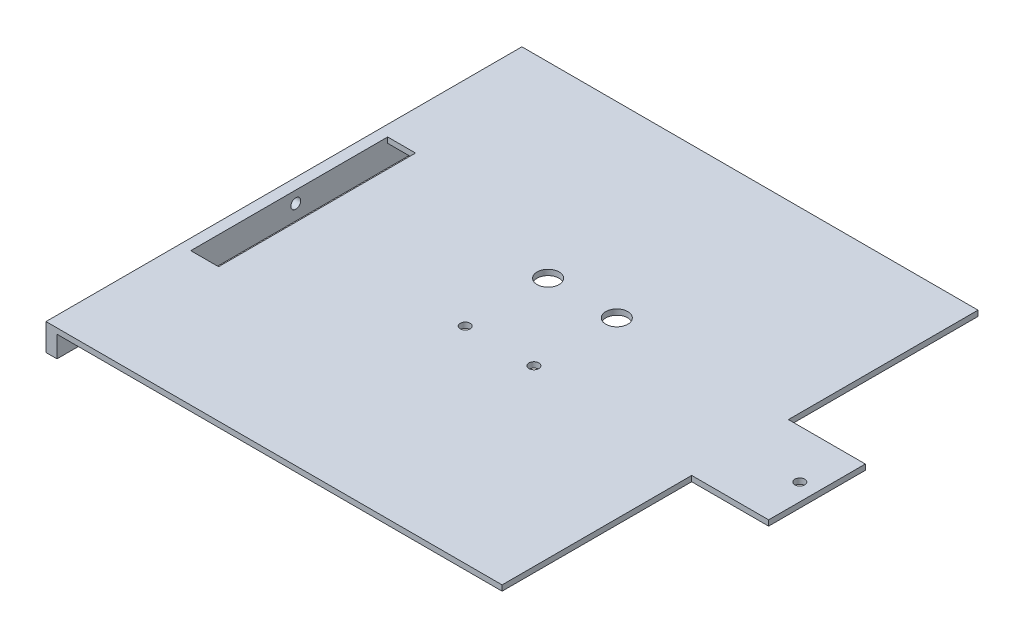
from build123d import *

# Parameters (mm, degrees)
BOSS_EXTRUDE1_DEPTH = 1.27
SKETCH2_R           = 1.143
CUT_EXTRUDE2_DEPTH  = 2.54
SKETCH3_R           = 2.54
SKETCH3_R_2         = 1.143
CUT_EXTRUDE3_DEPTH  = 2.54
SKETCH19_W          = 30.913141625
SKETCH19_H          = 1.27
BOSS_EXTRUDE2_DEPTH = 3.81
SKETCH20_W          = 33.557604238
SKETCH20_H          = 1.27
BOSS_EXTRUDE3_DEPTH = 3.81
SKETCH21_W          = 109.982
SKETCH21_H          = 6.204110365
BOSS_EXTRUDE4_DEPTH = 2.54
SKETCH22_R          = 1.143
CUT_EXTRUDE6_DEPTH  = 2.54


with BuildPart() as part:
    # Sketch1 → Boss-Extrude1 (new body)
    with BuildSketch(Plane(origin=(0, 0, 0), x_dir=(1, 0, 0), z_dir=(0, 1, 0))):
        Polygon((49.53, -54.991), (49.53, -11.176), (67.31, -11.176), (67.31, 11.176), (49.53, 11.176), (49.53, 54.991), (-49.53, 54.991), (-49.53, 21.433395762), (-46.907297859, 21.433395762), (-46.907297859, -24.077858375), (-49.53, -24.077858375), (-49.53, -54.991), align=None)
    extrude(amount=BOSS_EXTRUDE1_DEPTH)

    # Sketch2 → Cut-Extrude2 (cut)
    with BuildSketch(Plane(origin=(0, 1.27, 0), x_dir=(1, 0, 0), z_dir=(0, 1, 0))):
        with Locations(Location((63.345949026, 0, 0), (0, 0, 270))):
            Circle(SKETCH2_R)
    extrude(amount=-CUT_EXTRUDE2_DEPTH, mode=Mode.SUBTRACT)

    # Sketch3 → Cut-Extrude3 (cut)
    with BuildSketch(Plane(origin=(0, 1.27, 0), x_dir=(1, 0, 0), z_dir=(0, 1, 0))):
        with Locations(Location((-6.5275, 11.696076054, 0), (0, 0, 270))):
            Circle(SKETCH3_R)
        with Locations(Location((9.3475, 11.696076054, 0), (0, 0, 270))):
            Circle(SKETCH3_R)
        with Locations(Location((-6.5275, -7.461873946, 0), (0, 0, 270))):
            Circle(SKETCH3_R_2)
        with Locations(Location((9.3475, -7.461873946, 0), (0, 0, 270))):
            Circle(SKETCH3_R_2)
    extrude(amount=-CUT_EXTRUDE3_DEPTH, mode=Mode.SUBTRACT)

    # Sketch19 → Boss-Extrude2 (add)
    with BuildSketch(Plane.ZY.offset(49.53)):
        with Locations((39.534429188, 0.635)):
            Rectangle(SKETCH19_W, SKETCH19_H)
    extrude(amount=BOSS_EXTRUDE2_DEPTH)

    # Sketch20 → Boss-Extrude3 (add)
    with BuildSketch(Plane.ZY.offset(49.53)):
        with Locations((-38.212197881, 0.635)):
            Rectangle(SKETCH20_W, SKETCH20_H)
    extrude(amount=BOSS_EXTRUDE3_DEPTH)

    # Sketch21 → Boss-Extrude4 (add)
    with BuildSketch(Plane.ZY.offset(53.34)):
        with Locations((0, -1.832055183)):
            Rectangle(SKETCH21_W, SKETCH21_H)
    extrude(amount=BOSS_EXTRUDE4_DEPTH)

    # Sketch22 → Cut-Extrude6 (cut)
    with BuildSketch(Plane.ZY.offset(55.88)):
        with Locations((-0.192674888, -1.428814134)):
            Circle(SKETCH22_R)
    extrude(amount=-CUT_EXTRUDE6_DEPTH, mode=Mode.SUBTRACT)


solid = part.part
